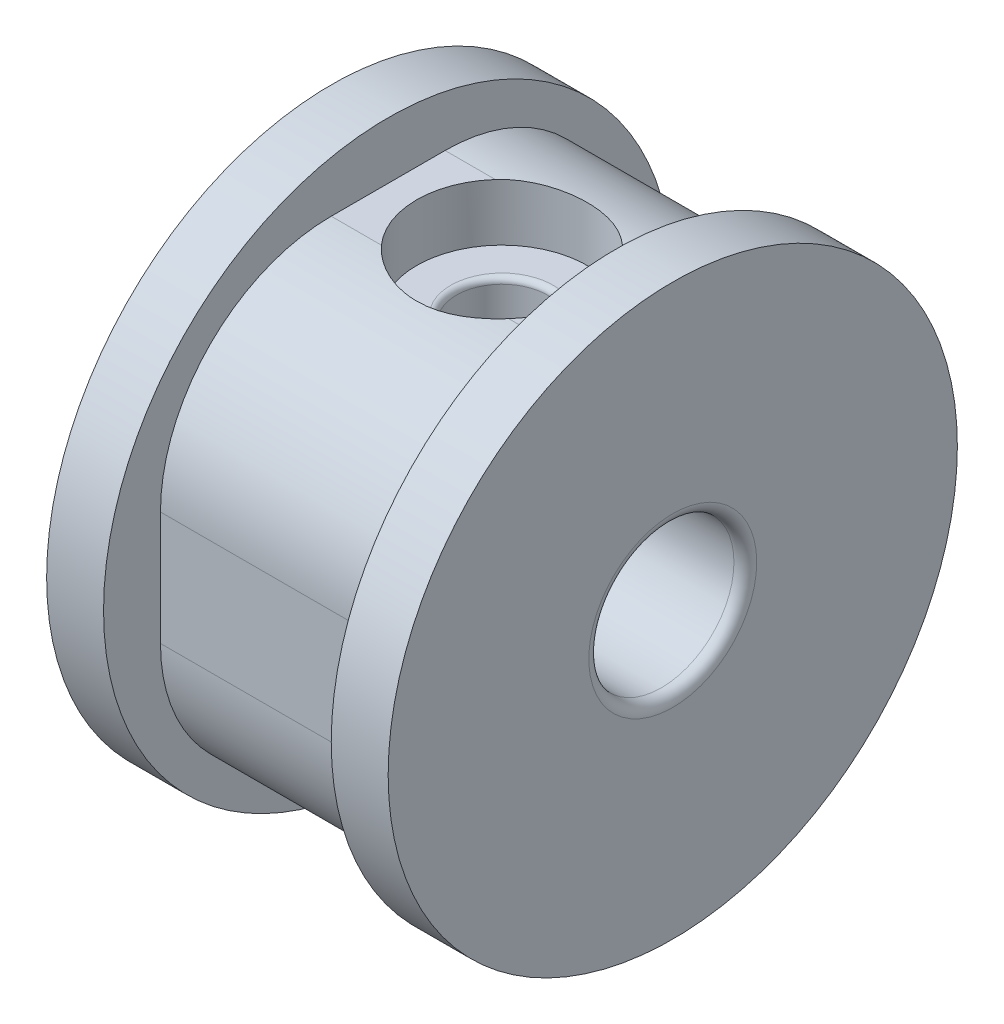
from build123d import *

# Parameters (mm, degrees)
SKETCH_1_W          = 16
SKETCH_1_H          = 16
EXTRUDE_1_DEPTH     = 8
FILLET_1_R          = 6
SKETCH_3_R          = 1.6
CUT_EXTRUDE_1_DEPTH = 4
SKETCH_4_R          = 3
CUT_EXTRUDE_2_DEPTH = 2
SKETCH_7_R          = 10
EXTRUDE_2_DEPTH     = 2
EXTRUDE_START       = 2
SKETCH_8_R          = 10
EXTRUDE_3_DEPTH     = 2
SKETCH_9_R          = 2.55
CUT_EXTRUDE_4_DEPTH = 22
FILLET_2_R          = 0.2
FILLET_3_R          = 0.4


with BuildPart() as part:
    # 草图1 → 凸台-拉伸1 (new body)
    with BuildSketch(Plane(origin=(0, 0, 0), x_dir=(0, 0, -1), z_dir=(1, 0, 0))):
        with Locations((-8, 8)):
            Rectangle(SKETCH_1_W, SKETCH_1_H)
    extrude(amount=EXTRUDE_1_DEPTH)

    # 圆角1
    fillet_1_edges = [part.edges().sort_by_distance(p)[0] for p in [
        (4, 0, 0),
        (4, 0, 16),
        (4, 16, 0),
        (4, 16, 16),
    ]]
    fillet(fillet_1_edges, radius=FILLET_1_R)

    # 草图3 → 切除-拉伸1 (cut)
    with BuildSketch(Plane(origin=(0, 16, 0), x_dir=(1, 0, 0), z_dir=(0, 1, 0))):
        with Locations((4, -8)):
            Circle(SKETCH_3_R)
    extrude(amount=-CUT_EXTRUDE_1_DEPTH, mode=Mode.SUBTRACT)

    # 草图4 → 切除-拉伸2 (cut)
    with BuildSketch(Plane(origin=(0, 16, 0), x_dir=(1, 0, 0), z_dir=(0, 1, 0))):
        with Locations((4, -8)):
            Circle(SKETCH_4_R)
    extrude(amount=-CUT_EXTRUDE_2_DEPTH, mode=Mode.SUBTRACT)

    # 草图7 → 凸台-拉伸2 (add)
    with BuildSketch(Plane(origin=(8, 0, 0), x_dir=(0, 0, -1), z_dir=(1, 0, 0))):
        with Locations((-8, 8)):
            Circle(SKETCH_7_R)
    extrude(amount=EXTRUDE_2_DEPTH)

    # 草图8 → 凸台-拉伸3 (add)
    with BuildSketch(Plane.ZY.offset(EXTRUDE_START)):
        with Locations((8, 8)):
            Circle(SKETCH_8_R)
    extrude(amount=-EXTRUDE_3_DEPTH)

    # 草图9 → 切除-拉伸4 (cut)
    with BuildSketch(Plane.ZY.offset(2)):
        with Locations((8, 8)):
            Circle(SKETCH_9_R)
    extrude(amount=-CUT_EXTRUDE_4_DEPTH, mode=Mode.SUBTRACT)

    # 圆角2
    fillet_2_edges = [part.edges().sort_by_distance(p)[0] for p in [
        (2.4, 14, 8),
    ]]
    fillet(fillet_2_edges, radius=FILLET_2_R)

    # 圆角3
    fillet_3_edges = [part.edges().sort_by_distance(p)[0] for p in [
        (-2, 8, 5.45),
        (10, 8, 5.45),
    ]]
    fillet(fillet_3_edges, radius=FILLET_3_R)


solid = part.part
